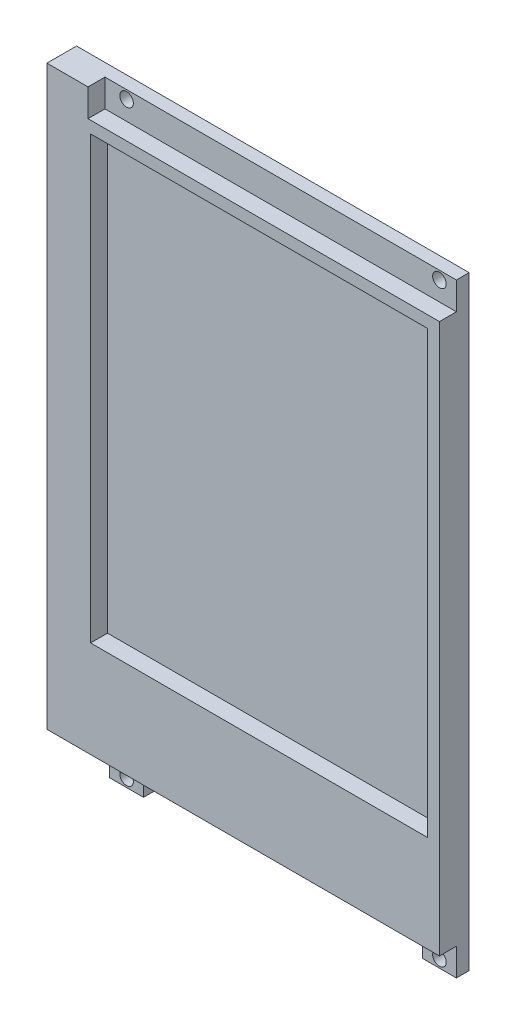
from build123d import *

# Parameters (mm, degrees)
ESQUISSE1_W             = 92.6
ESQUISSE1_H             = 142.6
BASE_EXTRUSION_DEPTH    = 7
ESQUISSE4_R             = 1.6
ENL_V_MAT_EXTRU_2_DEPTH = 108.918117107
ESQUISSE2_W             = 79.5
ESQUISSE2_H             = 104
ENL_V_MAT_EXTRU_3_DEPTH = 4
ESQUISSE6_W             = 86.3
ESQUISSE6_H             = 9.5
ENL_V_MAT_EXTRU_4_DEPTH = 4
ESQUISSE7_W             = 120
ESQUISSE7_H             = 17.9
ENL_V_MAT_EXTRU_6_DEPTH = 4
ESQUISSE8_W             = 13.8
ESQUISSE8_H             = 8.9
ESQUISSE8_W_2           = 65.8
ENL_V_MAT_EXTRU_7_DEPTH = 15


with BuildPart() as part:
    # Esquisse1 → Base-Extrusion (new body)
    with BuildSketch(Plane.XY):
        with Locations((1.3, -25.3)):
            Rectangle(ESQUISSE1_W, ESQUISSE1_H)
    extrude(amount=BASE_EXTRUSION_DEPTH)

    # Esquisse4 → Enlèv. mat.-Extru.2 (cut, through all)
    with BuildSketch(Plane.XY.offset(7)):
        with Locations((-30.2, 44)):
            Circle(ESQUISSE4_R)
        with Locations((43.6, 44)):
            Circle(ESQUISSE4_R)
        with Locations((-30.2, -94.6)):
            Circle(ESQUISSE4_R)
        with Locations((43.6, -94.6)):
            Circle(ESQUISSE4_R)
    extrude(amount=-ENL_V_MAT_EXTRU_2_DEPTH, mode=Mode.SUBTRACT)

    # Esquisse2 → Enlèv. mat.-Extru.3 (cut)
    with BuildSketch(Plane.XY.offset(7)):
        with Locations((5.05, -15.3)):
            Rectangle(ESQUISSE2_W, ESQUISSE2_H)
    extrude(amount=-ENL_V_MAT_EXTRU_3_DEPTH, mode=Mode.SUBTRACT)

    # Esquisse6 → Enlèv. mat.-Extru.4 (cut)
    with BuildSketch(Plane.XY.offset(7)):
        with Locations((7.85, 44.25)):
            Rectangle(ESQUISSE6_W, ESQUISSE6_H)
    extrude(amount=-ENL_V_MAT_EXTRU_4_DEPTH, mode=Mode.SUBTRACT)

    # Esquisse7 → Enlèv. mat.-Extru.6 (cut)
    with BuildSketch(Plane.XY.offset(7)):
        with Locations((0, -99.05)):
            Rectangle(ESQUISSE7_W, ESQUISSE7_H)
    extrude(amount=-ENL_V_MAT_EXTRU_6_DEPTH, mode=Mode.SUBTRACT)

    # Esquisse8 → Enlèv. mat.-Extru.7 (cut)
    with BuildSketch(Plane(origin=(0, 0, 0), x_dir=(-1, 0, 0), z_dir=(0, 0, -1))):
        with Locations((41.1, -94.55)):
            Rectangle(ESQUISSE8_W, ESQUISSE8_H)
        with Locations((-6.7, -94.55)):
            Rectangle(ESQUISSE8_W_2, ESQUISSE8_H)
    extrude(amount=-ENL_V_MAT_EXTRU_7_DEPTH, mode=Mode.SUBTRACT)


solid = part.part
